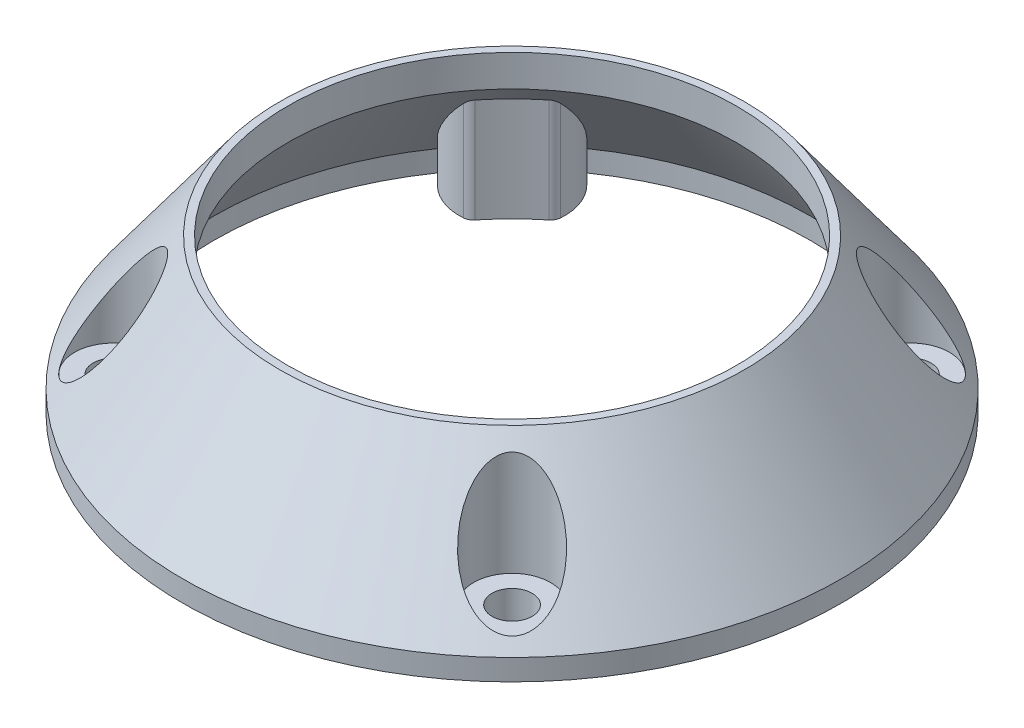
from build123d import *

# Parameters (mm, degrees)
BOSS_EXTRUDE2_REACH = 61.404
SKETCH6_R           = 2.413
CUT_EXTRUDE3_DEPTH  = 60.403601076
SKETCH7_R           = 4.6355
CUT_EXTRUDE6_DEPTH  = 15.723362
SKETCH8_R           = 51.318264322
CUT_EXTRUDE7_DEPTH  = 1.27
FILLET1_R           = 1.27


with BuildPart() as part:
    # Sketch3 → Revolve1 (revolve)
    with BuildSketch(Plane.XY):
        Polygon((35.89, 0), (27, 12.094590252), (27, 17.174590252), (39.624, 0), (39.624, -2.54), (35.89, -2.54), align=None)
    revolve(axis=Axis((0, -74.58294497, 0), (0, 1, 0)))

    # Boss-Extrude2: up to this cone (the profile starts inside it)
    boss_extrude2_end = Plane(origin=(0, -2.54, 0), z_dir=(0, -1, 0)).offset(-51.367315551) * Cone(1e-06, 111.011758661, 151.028315551, align=(Align.CENTER, Align.CENTER, Align.MIN), mode=Mode.PRIVATE)
    # Sketch4 → Boss-Extrude2 (add, up to the surface)
    with BuildSketch(Plane.XZ.offset(2.54), mode=Mode.PRIVATE) as boss_extrude2_sk1:
        with BuildLine():
            Line((-19.217748099, 28.19800422), (-20.487557981, 29.467814102))
            ThreePointArc((-20.487557981, 29.467814102), (-25.378062377, 25.378062377), (-29.467814102, 20.487557981))
            Line((-29.467814102, 20.487557981), (-28.19800422, 19.217748099))
            ThreePointArc((-28.19800422, 19.217748099), (-25.628248167, 17.655217954), (-22.627714101, 17.450420612))
            ThreePointArc((-22.627714101, 17.450420612), (-20.205576272, 20.205576272), (-17.450420612, 22.627714101))
            ThreePointArc((-17.450420612, 22.627714101), (-17.655217954, 25.628248167), (-19.217748099, 28.19800422))
        make_face()
    boss_extrude2_tool1 = extrude(boss_extrude2_sk1.sketch, amount=-BOSS_EXTRUDE2_REACH, mode=Mode.PRIVATE) & boss_extrude2_end
    add(boss_extrude2_tool1.solids().sort_by_distance((-22.84989, -2.54, 22.84989))[0])
    # Sketch4 → Boss-Extrude2 (add, up to the surface)
    with BuildSketch(Plane.XZ.offset(2.54), mode=Mode.PRIVATE) as boss_extrude2_sk2:
        with BuildLine():
            Line((28.19800422, 19.217748099), (29.467814102, 20.487557981))
            ThreePointArc((29.467814102, 20.487557981), (25.378062377, 25.378062377), (20.487557981, 29.467814102))
            Line((20.487557981, 29.467814102), (19.217748099, 28.19800422))
            ThreePointArc((19.217748099, 28.19800422), (17.655217954, 25.628248167), (17.450420612, 22.627714101))
            ThreePointArc((17.450420612, 22.627714101), (20.205576272, 20.205576272), (22.627714101, 17.450420612))
            ThreePointArc((22.627714101, 17.450420612), (25.628248167, 17.655217954), (28.19800422, 19.217748099))
        make_face()
    boss_extrude2_tool2 = extrude(boss_extrude2_sk2.sketch, amount=-BOSS_EXTRUDE2_REACH, mode=Mode.PRIVATE) & boss_extrude2_end
    add(boss_extrude2_tool2.solids().sort_by_distance((22.84989, -2.54, 22.84989))[0])
    # Sketch4 → Boss-Extrude2 (add, up to the surface)
    with BuildSketch(Plane.XZ.offset(2.54), mode=Mode.PRIVATE) as boss_extrude2_sk3:
        with BuildLine():
            Line((19.217748099, -28.19800422), (20.487557981, -29.467814102))
            ThreePointArc((20.487557981, -29.467814102), (25.378062377, -25.378062377), (29.467814102, -20.487557981))
            Line((29.467814102, -20.487557981), (28.19800422, -19.217748099))
            ThreePointArc((28.19800422, -19.217748099), (25.628248167, -17.655217954), (22.627714101, -17.450420612))
            ThreePointArc((22.627714101, -17.450420612), (20.205576272, -20.205576272), (17.450420612, -22.627714101))
            ThreePointArc((17.450420612, -22.627714101), (17.655217954, -25.628248167), (19.217748099, -28.19800422))
        make_face()
    boss_extrude2_tool3 = extrude(boss_extrude2_sk3.sketch, amount=-BOSS_EXTRUDE2_REACH, mode=Mode.PRIVATE) & boss_extrude2_end
    add(boss_extrude2_tool3.solids().sort_by_distance((22.84989, -2.54, -22.84989))[0])
    # Sketch4 → Boss-Extrude2 (add, up to the surface)
    with BuildSketch(Plane.XZ.offset(2.54), mode=Mode.PRIVATE) as boss_extrude2_sk4:
        with BuildLine():
            Line((-28.19800422, -19.217748099), (-29.467814102, -20.487557981))
            ThreePointArc((-29.467814102, -20.487557981), (-25.378062377, -25.378062377), (-20.487557981, -29.467814102))
            Line((-20.487557981, -29.467814102), (-19.217748099, -28.19800422))
            ThreePointArc((-19.217748099, -28.19800422), (-17.655217954, -25.628248167), (-17.450420612, -22.627714101))
            ThreePointArc((-17.450420612, -22.627714101), (-20.205576272, -20.205576272), (-22.627714101, -17.450420612))
            ThreePointArc((-22.627714101, -17.450420612), (-25.628248167, -17.655217954), (-28.19800422, -19.217748099))
        make_face()
    boss_extrude2_tool4 = extrude(boss_extrude2_sk4.sketch, amount=-BOSS_EXTRUDE2_REACH, mode=Mode.PRIVATE) & boss_extrude2_end
    add(boss_extrude2_tool4.solids().sort_by_distance((-22.84989, -2.54, -22.84989))[0])

    # Sketch6 → Cut-Extrude3 (cut, through all)
    with BuildSketch(Plane.XZ.offset(2.54)):
        with Locations((-23.977283843, 23.977283843)):
            Circle(SKETCH6_R)
        with Locations((23.977283843, 23.977283843)):
            Circle(SKETCH6_R)
        with Locations((23.977283843, -23.977283843)):
            Circle(SKETCH6_R)
        with Locations((-23.977283843, -23.977283843)):
            Circle(SKETCH6_R)
    extrude(amount=-CUT_EXTRUDE3_DEPTH, mode=Mode.SUBTRACT)

    # Sketch7 → Cut-Extrude6 (cut)
    with BuildSketch(Plane(origin=(0, 17.174590252, 0), x_dir=(1, 0, 0), z_dir=(0, 1, 0))):
        with Locations((-23.977283843, 23.977283843)):
            Circle(SKETCH7_R)
        with Locations((23.977283843, 23.977283843)):
            Circle(SKETCH7_R)
        with Locations((23.977283843, -23.977283843)):
            Circle(SKETCH7_R)
        with Locations((-23.977283843, -23.977283843)):
            Circle(SKETCH7_R)
    extrude(amount=-CUT_EXTRUDE6_DEPTH, mode=Mode.SUBTRACT)

    # Sketch8 → Cut-Extrude7 (cut)
    with BuildSketch(Plane(origin=(0, 17.174590252, 0), x_dir=(1, 0, 0), z_dir=(0, 1, 0))):
        Circle(SKETCH8_R)
    extrude(amount=-CUT_EXTRUDE7_DEPTH, mode=Mode.SUBTRACT)

    # Fillet1
    fillet1_edges = [part.edges().sort_by_distance(p)[0] for p in [
        (22.627714101, 3.705924076, -17.450420612),
        (17.450420612, 3.705924076, -22.627714101),
        (-22.627714101, 3.705924076, -17.450420612),
        (-17.450420612, 3.705924076, -22.627714101),
        (-22.627714101, 3.705924076, 17.450420612),
        (-17.450420612, 3.705924076, 22.627714101),
        (17.450420612, 3.705924076, 22.627714101),
        (22.627714101, 3.705924076, 17.450420612),
    ]]
    fillet(fillet1_edges, radius=FILLET1_R)


solid = part.part
